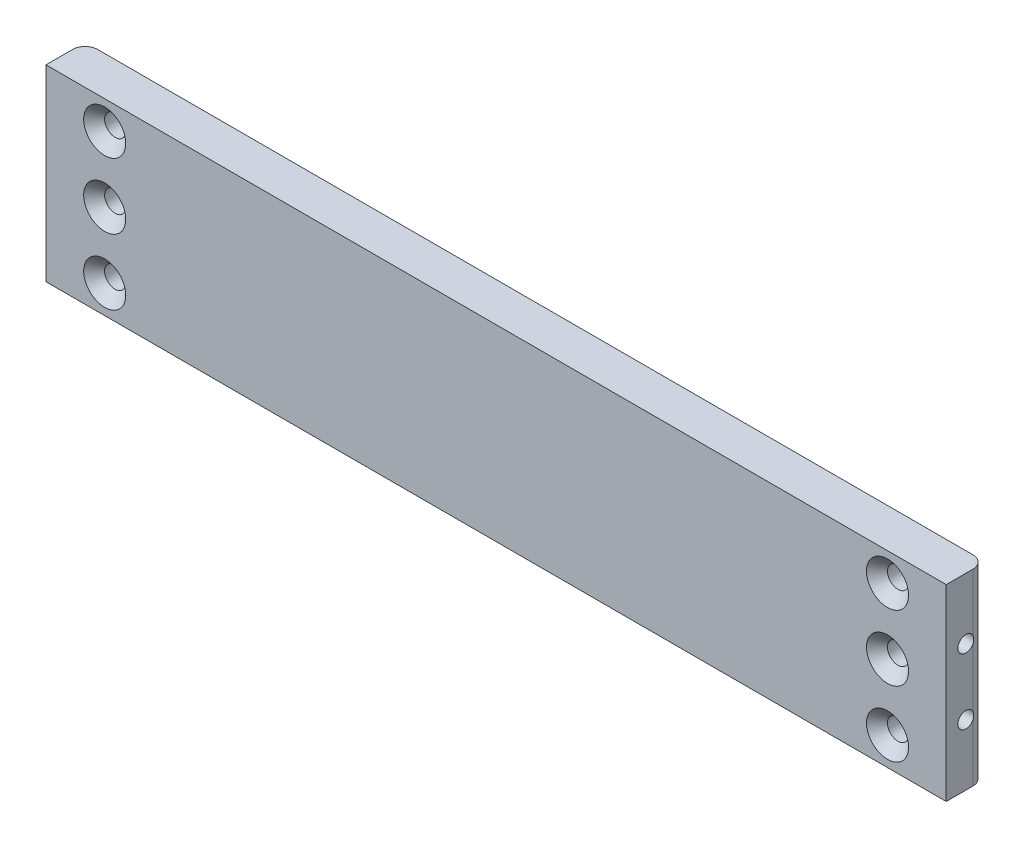
from build123d import *

# Parameters (mm, degrees)
RESSALTO_EXTRUS_O1_DEPTH                            = 25
ESCAREADO_PARA_PARAFUSO_ALLEN_SEXTAVADO_D           = 13.5
ESCAREADO_PARA_PARAFUSO_ALLEN_SEXTAVADO_DEPTH       = 25
ESCAREADO_PARA_PARAFUSO_ALLEN_SEXTAVADO_CSINK_D     = 26.88
ESCAREADO_PARA_PARAFUSO_ALLEN_SEXTAVADO_CSINK_ANGLE = 90
ESCAREADO_PARA_PARAFUSO_ALLEN_SEXTAVADO_TIP         = 4.055809178
FURO_ROSCADO_DE_M121_AT_2_COUNT                     = 2
FURO_ROSCADO_DE_M121_AT_2_PITCH                     = 42
FILETE1_R                                           = 8


with BuildPart() as part:
    # Esboço1 → Ressalto-extrusão1 (new body)
    with BuildSketch(Plane.XY):
        Polygon((-25, 120), (500, 120), (525, 120), (525, 0), (500, 0), (-25, 0), (-50, 0), (-50, 120), align=None)
    extrude(amount=RESSALTO_EXTRUS_O1_DEPTH)

    # Escareado para parafuso Allen sextavado escareado de M121
    with Locations(Plane.XY.offset(25)):
        with Locations((-12.5, 102), (-12.5, 60), (-12.5, 18), (487.5, 102), (487.5, 60), (487.5, 18)):
            CounterSinkHole(ESCAREADO_PARA_PARAFUSO_ALLEN_SEXTAVADO_D / 2, ESCAREADO_PARA_PARAFUSO_ALLEN_SEXTAVADO_CSINK_D / 2, depth=ESCAREADO_PARA_PARAFUSO_ALLEN_SEXTAVADO_DEPTH, counter_sink_angle=ESCAREADO_PARA_PARAFUSO_ALLEN_SEXTAVADO_CSINK_ANGLE)
            with Locations((0, 0, -(ESCAREADO_PARA_PARAFUSO_ALLEN_SEXTAVADO_DEPTH + ESCAREADO_PARA_PARAFUSO_ALLEN_SEXTAVADO_TIP / 2))):  # 118° drill point
                Cone(0, ESCAREADO_PARA_PARAFUSO_ALLEN_SEXTAVADO_D / 2, ESCAREADO_PARA_PARAFUSO_ALLEN_SEXTAVADO_TIP, mode=Mode.SUBTRACT)

    # Esboço6 → Furo roscado de M121 (revolve, cut)
    with BuildSketch(Plane(origin=(-50, 81, 12.5), x_dir=(0, 0, 1), z_dir=(0, 1, 0))):
        Polygon((0, 0), (0, 53.064389157), (5.1, 50), (5.1, 0), align=None)
    furo_roscado_de_m121 = revolve(axis=Axis((-56.35, 81, 12.5), (1, 0, 0)), mode=Mode.SUBTRACT)

    # Furo roscado de M121 at 2: Furo roscado de M121 ×2
    with Locations(*[(0, -i * FURO_ROSCADO_DE_M121_AT_2_PITCH, 0) for i in range(1, FURO_ROSCADO_DE_M121_AT_2_COUNT)]):
        add(furo_roscado_de_m121, mode=Mode.SUBTRACT)

    # Espelhar1: Furo roscado de M121 across plane
    add(furo_roscado_de_m121.mirror(Plane.ZY.offset(-237.5)), mode=Mode.SUBTRACT)

    # Espelhar1 copy 1 sketch → Espelhar1 copy 1 (revolve, cut)
    with BuildSketch(Plane(origin=(525, 39, 12.5), x_dir=(0, 0, 1), z_dir=(0, 1, 0))):
        Polygon((0, 0), (0, -53.064389157), (5.1, -50), (5.1, 0), align=None)
    revolve(axis=Axis((531.35, 39, 12.5), (1, 0, 0)), mode=Mode.SUBTRACT)

    # Filete1
    # the kernel refuses this fillet: 8 mm, written as the material it takes off along each edge
    with BuildSketch(Plane(origin=(-50, -20, 0), x_dir=(0, 0, 1), z_dir=(0, 1, 0)), Plane(origin=(525, 140, 0), x_dir=(0, 0, 1), z_dir=(0, -1, 0))) as filete1_piece_1:
        with BuildLine():
            CenterArc((FILETE1_R, FILETE1_R), FILETE1_R, 180, 90)
            Line((0, FILETE1_R), (0, 0))
            Line((0, 0), (FILETE1_R, 0))
        make_face()
    extrude(amount=160, mode=Mode.SUBTRACT)


solid = part.part
